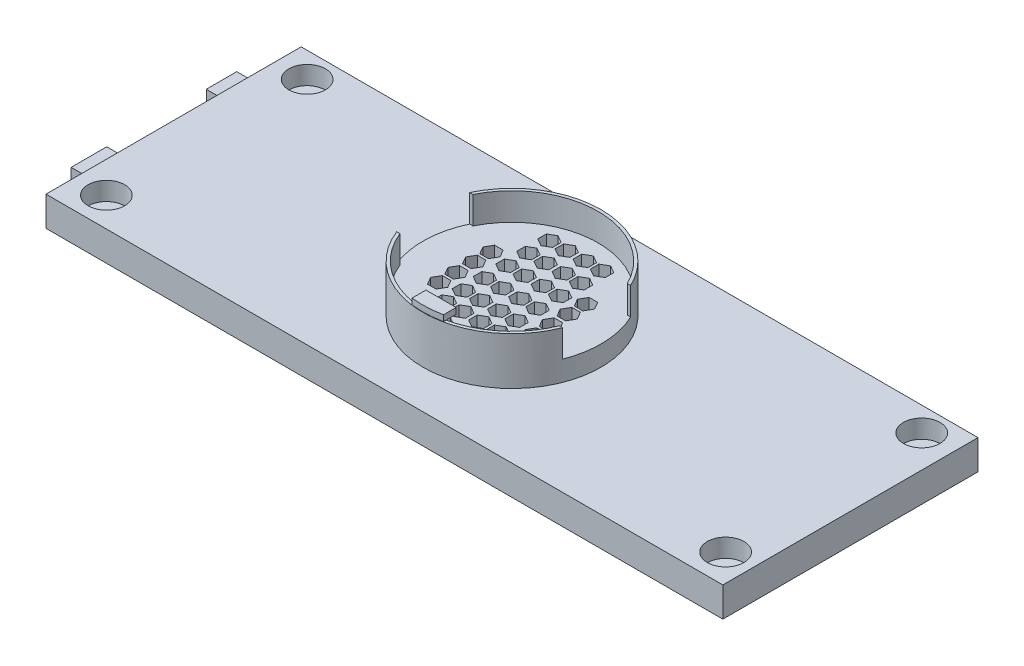
from build123d import *

# Parameters (mm, degrees)
SKETCH1_W           = 114
SKETCH1_H           = 42.97487903
BOSS_EXTRUDE1_DEPTH = 5
SKETCH3_R           = 3.08
CUT_EXTRUDE1_DEPTH  = 3.1
SKETCH5_W           = 5.142433448
SKETCH5_H           = 2
SKETCH5_W_2         = 6
SKETCH5_H_2         = 2.003550683
BOSS_EXTRUDE2_DEPTH = 3.1
SKETCH6_R           = 15
BOSS_EXTRUDE3_DEPTH = 8
SKETCH8_R           = 14.5
CUT_EXTRUDE2_DEPTH  = 4.6
SKETCH9_W           = 39.287811744
SKETCH9_H           = 11.865369085
CUT_EXTRUDE5_DEPTH  = 9.6
BOSS_EXTRUDE5_DEPTH = 1
CUT_EXTRUDE6_DEPTH  = 10


with BuildPart() as part:
    # Sketch1 → Boss-Extrude1 (new body)
    with BuildSketch(Plane(origin=(0, 0, 0), x_dir=(1, 0, 0), z_dir=(0, 1, 0))):
        Rectangle(SKETCH1_W, SKETCH1_H)
    extrude(amount=BOSS_EXTRUDE1_DEPTH)

    # Sketch3 → Cut-Extrude1 (cut)
    with BuildSketch(Plane(origin=(0, 5, 0), x_dir=(1, 0, 0), z_dir=(0, 1, 0))):
        with Locations((-51.753086156, 17.246929099)):
            Circle(SKETCH3_R)
        with Locations((-51.753086156, -16.564851847)):
            Circle(SKETCH3_R)
        with Locations((51.584956943, 17.425212087)):
            Circle(SKETCH3_R)
        with Locations((52.43781039, -16.458146722)):
            Circle(SKETCH3_R)
    extrude(amount=-CUT_EXTRUDE1_DEPTH, mode=Mode.SUBTRACT)

    # Sketch5 → Boss-Extrude2 (add)
    with BuildSketch(Plane.ZY.offset(57)):
        with Locations((-11.176561417, 2.70029737)):
            Rectangle(SKETCH5_W, SKETCH5_H)
        with Locations((11.157157367, 2.691921307)):
            Rectangle(SKETCH5_W_2, SKETCH5_H_2)
    extrude(amount=BOSS_EXTRUDE2_DEPTH)

    # Sketch6 → Boss-Extrude3 (add)
    with BuildSketch(Plane(origin=(0, 5, 0), x_dir=(1, 0, 0), z_dir=(0, 1, 0))):
        Circle(SKETCH6_R)
    extrude(amount=BOSS_EXTRUDE3_DEPTH)

    # Sketch8 → Cut-Extrude2 (cut)
    with BuildSketch(Plane(origin=(0, 13, 0), x_dir=(1, 0, 0), z_dir=(0, 1, 0))):
        Circle(SKETCH8_R)
    extrude(amount=-CUT_EXTRUDE2_DEPTH, mode=Mode.SUBTRACT)

    # Sketch9 → Cut-Extrude5 (cut)
    with BuildSketch(Plane(origin=(0, 8.4, 0), x_dir=(1, 0, 0), z_dir=(0, 1, 0))):
        with Locations((1.303444601, 0.497081388)):
            Rectangle(SKETCH9_W, SKETCH9_H)
    extrude(amount=CUT_EXTRUDE5_DEPTH, mode=Mode.SUBTRACT)

    # Sketch11 → Boss-Extrude5 (add)
    with BuildSketch(Plane(origin=(0, 13, 0), x_dir=(1, 0, 0), z_dir=(0, 1, 0))):
        with BuildLine():
            Line((-2.008566412, -12.483358221), (-2.008566412, -14.813807369))
            ThreePointArc((-2.008566412, -14.813807369), (0.540430025, -14.915750705), (3.072767456, -14.607461209))
            Line((3.072767456, -14.607461209), (3.072767456, -12.483358221))
            Line((3.072767456, -12.483358221), (-2.008566412, -12.483358221))
        make_face()
    extrude(amount=BOSS_EXTRUDE5_DEPTH)

    # Sketch12 → Cut-Extrude6 (cut)
    with BuildSketch(Plane.XZ):
        Polygon((-1.381374518, -4.971139616), (-0.132784083, -4.250265592), (-0.132784083, -2.808517545), (-1.381374518, -2.087643522), (-2.629964952, -2.808517545), (-2.629964952, -4.250265592), align=None)
        Polygon((-4.289587549, -4.971139616), (-3.040997114, -4.250265592), (-3.040997114, -2.808517545), (-4.289587549, -2.087643522), (-5.538177984, -2.808517545), (-5.538177984, -4.250265592), align=None)
        Polygon((4.546381521, -5.001007602), (5.794971955, -4.280133578), (5.794971955, -2.838385531), (4.546381521, -2.117511507), (3.297791086, -2.838385531), (3.297791086, -4.280133578), align=None)
        Polygon((1.638168489, -5.001007602), (2.886758924, -4.280133578), (2.886758924, -2.838385531), (1.638168489, -2.117511507), (0.389578055, -2.838385531), (0.389578055, -4.280133578), align=None)
        Polygon((-1.44283189, -1.23420754), (-0.194241456, -0.513333516), (-0.194241456, 0.928414531), (-1.44283189, 1.649288554), (-2.691422325, 0.928414531), (-2.691422325, -0.513333516), align=None)
        Polygon((-4.351044922, -1.23420754), (-3.102454487, -0.513333516), (-3.102454487, 0.928414531), (-4.351044922, 1.649288554), (-5.599635356, 0.928414531), (-5.599635356, -0.513333516), align=None)
        Polygon((4.484924148, -1.264075525), (5.733514583, -0.543201502), (5.733514583, 0.898546545), (4.484924148, 1.619420569), (3.236333713, 0.898546545), (3.236333713, -0.543201502), align=None)
        Polygon((1.576711117, -1.264075525), (2.825301551, -0.543201502), (2.825301551, 0.898546545), (1.576711117, 1.619420569), (0.328120682, 0.898546545), (0.328120682, -0.543201502), align=None)
        Polygon((-1.44283189, 2.30846757), (-0.194241456, 3.029341594), (-0.194241456, 4.471089641), (-1.44283189, 5.191963664), (-2.691422325, 4.471089641), (-2.691422325, 3.029341594), align=None)
        Polygon((-4.351044922, 2.30846757), (-3.102454487, 3.029341594), (-3.102454487, 4.471089641), (-4.351044922, 5.191963664), (-5.599635356, 4.471089641), (-5.599635356, 3.029341594), align=None)
        Polygon((4.484924148, 2.278599584), (5.733514583, 2.999473608), (5.733514583, 4.441221655), (4.484924148, 5.162095679), (3.236333713, 4.441221655), (3.236333713, 2.999473608), align=None)
        Polygon((1.576711117, 2.278599584), (2.825301551, 2.999473608), (2.825301551, 4.441221655), (1.576711117, 5.162095679), (0.328120682, 4.441221655), (0.328120682, 2.999473608), align=None)
        Polygon((-1.424844788, 5.51653605), (-0.176254353, 6.237410074), (-0.176254353, 7.679158121), (-1.424844788, 8.400032145), (-2.673435223, 7.679158121), (-2.673435223, 6.237410074), align=None)
        Polygon((-4.333057819, 5.51653605), (-3.084467385, 6.237410074), (-3.084467385, 7.679158121), (-4.333057819, 8.400032145), (-5.581648254, 7.679158121), (-5.581648254, 6.237410074), align=None)
        Polygon((4.50291125, 5.486668065), (5.751501685, 6.207542088), (5.751501685, 7.649290135), (4.50291125, 8.370164159), (3.254320816, 7.649290135), (3.254320816, 6.207542088), align=None)
        Polygon((1.594698219, 5.486668065), (2.843288654, 6.207542088), (2.843288654, 7.649290135), (1.594698219, 8.370164159), (0.346107784, 7.649290135), (0.346107784, 6.207542088), align=None)
        Polygon((-1.406449515, 8.922934367), (-0.157859081, 9.643808391), (-0.157859081, 11.085556438), (-1.406449515, 11.806430461), (-2.65503995, 11.085556438), (-2.65503995, 9.643808391), align=None)
        Polygon((-4.314662547, 8.922934367), (-3.066072112, 9.643808391), (-3.066072112, 11.085556438), (-4.314662547, 11.806430461), (-5.563252981, 11.085556438), (-5.563252981, 9.643808391), align=None)
        Polygon((4.521306523, 8.893066382), (5.769896958, 9.613940405), (5.769896958, 11.055688452), (4.521306523, 11.776562476), (3.272716088, 11.055688452), (3.272716088, 9.613940405), align=None)
        Polygon((1.613093492, 8.893066382), (2.861683926, 9.613940405), (2.861683926, 11.055688452), (1.613093492, 11.776562476), (0.364503057, 11.055688452), (0.364503057, 9.613940405), align=None)
        Polygon((-1.466720513, -8.578903548), (-0.218130079, -7.858029525), (-0.218130079, -6.416281478), (-1.466720513, -5.695407454), (-2.715310948, -6.416281478), (-2.715310948, -7.858029525), align=None)
        Polygon((-4.374933545, -8.578903548), (-3.12634311, -7.858029525), (-3.12634311, -6.416281478), (-4.374933545, -5.695407454), (-5.623523979, -6.416281478), (-5.623523979, -7.858029525), align=None)
        Polygon((4.461035525, -8.608771534), (5.70962596, -7.88789751), (5.70962596, -6.446149463), (4.461035525, -5.72527544), (3.212445091, -6.446149463), (3.212445091, -7.88789751), align=None)
        Polygon((1.552822494, -8.608771534), (2.801412928, -7.88789751), (2.801412928, -6.446149463), (1.552822494, -5.72527544), (0.304232059, -6.446149463), (0.304232059, -7.88789751), align=None)
        Polygon((-1.502478081, -12.162894804), (-0.253887646, -11.44202078), (-0.253887646, -10.000272733), (-1.502478081, -9.27939871), (-2.751068515, -10.000272733), (-2.751068515, -11.44202078), align=None)
        Polygon((-4.410691112, -12.162894804), (-3.162100678, -11.44202078), (-3.162100678, -10.000272733), (-4.410691112, -9.27939871), (-5.659281547, -10.000272733), (-5.659281547, -11.44202078), align=None)
        Polygon((4.425277958, -12.19276279), (5.673868392, -11.471888766), (5.673868392, -10.030140719), (4.425277958, -9.309266696), (3.176687523, -10.030140719), (3.176687523, -11.471888766), align=None)
        Polygon((1.517064926, -12.19276279), (2.765655361, -11.471888766), (2.765655361, -10.030140719), (1.517064926, -9.309266696), (0.268474492, -10.030140719), (0.268474492, -11.471888766), align=None)
        Polygon((-6.210185925, -1.290453118), (-6.931059949, -0.041862683), (-8.372807996, -0.041862683), (-9.09368202, -1.290453118), (-8.372807996, -2.539043553), (-6.931059949, -2.539043553), align=None)
        Polygon((-6.210185925, -4.198666149), (-6.931059949, -2.950075715), (-8.372807996, -2.950075715), (-9.09368202, -4.198666149), (-8.372807996, -5.447256584), (-6.931059949, -5.447256584), align=None)
        Polygon((-6.18031794, 4.63730292), (-6.901191963, 5.885893355), (-8.34294001, 5.885893355), (-9.063814034, 4.63730292), (-8.34294001, 3.388712486), (-6.901191963, 3.388712486), align=None)
        Polygon((-6.18031794, 1.729089889), (-6.901191963, 2.977680324), (-8.34294001, 2.977680324), (-9.063814034, 1.729089889), (-8.34294001, 0.480499454), (-6.901191963, 0.480499454), align=None)
        Polygon((9.364060005, -1.631856694), (8.643185981, -0.383266259), (7.201437934, -0.383266259), (6.480563911, -1.631856694), (7.201437934, -2.880447128), (8.643185981, -2.880447128), align=None)
        Polygon((9.364060005, -4.540069725), (8.643185981, -3.29147929), (7.201437934, -3.29147929), (6.480563911, -4.540069725), (7.201437934, -5.78866016), (8.643185981, -5.78866016), align=None)
        Polygon((9.393927991, 4.295899345), (8.673053967, 5.544489779), (7.23130592, 5.544489779), (6.510431896, 4.295899345), (7.23130592, 3.04730891), (8.673053967, 3.04730891), align=None)
        Polygon((9.393927991, 1.387686313), (8.673053967, 2.636276748), (7.23130592, 2.636276748), (6.510431896, 1.387686313), (7.23130592, 0.139095879), (8.673053967, 0.139095879), align=None)
    extrude(amount=-CUT_EXTRUDE6_DEPTH, mode=Mode.SUBTRACT)


solid = part.part
